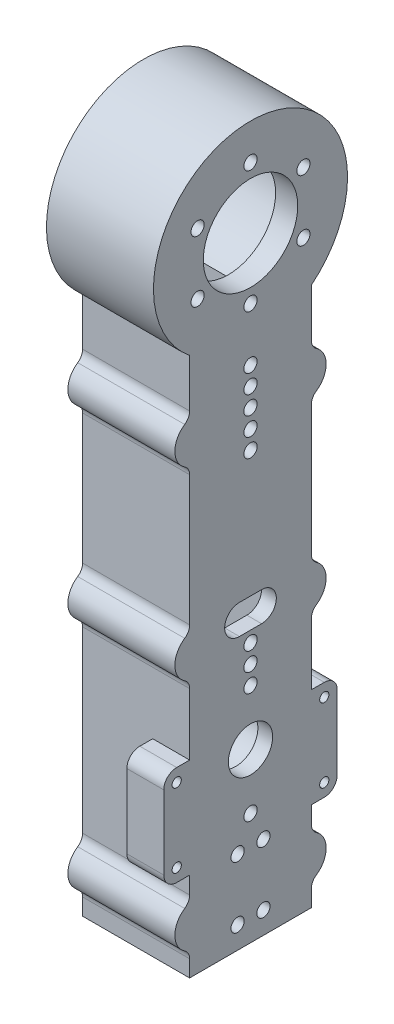
from build123d import *

# Parameters (mm, degrees)
SKETCH2_R                 = 20.3
SKETCH2_R_2               = 12.8
SKETCH2_R_3               = 8
SKETCH2_R_4               = 6
BOSS_EXTRUDE1_DEPTH       = 29
CUT_EXTRUDE1_START        = -29
SKETCH2_3_R               = 20.3
SKETCH2_3_R_2             = 12.8
CUT_EXTRUDE1_DEPTH        = 23
CUT_EXTRUDE3_START        = -29
SKETCH2_5_R               = 8
CUT_EXTRUDE3_DEPTH        = 8
CUT_EXTRUDE4_START        = -21
CUT_EXTRUDE4_DEPTH        = 17
CUT_EXTRUDE5_START        = -29
SKETCH2_7_R               = 8
CUT_EXTRUDE5_DEPTH        = 25
CUT_EXTRUDE6_START        = -29
CUT_EXTRUDE6_DEPTH        = 19
CUT_EXTRUDE7_START        = -29
CUT_EXTRUDE7_DEPTH        = 19
M3_CLEARANCE_HOLE1_D      = 3.6
M3X0_5_TAPPED_HOLE1_D     = 3.6
M3X0_5_TAPPED_HOLE1_DEPTH = 7.5
M3X0_5_TAPPED_HOLE1_TIP   = 1.081549114
M3_CLEARANCE_HOLE2_D      = 3.6
CIRPATTERN1_COUNT         = 6
M3X0_5_TAPPED_HOLE2_D     = 2.5
BOSS_EXTRUDE2_START       = -29
BOSS_EXTRUDE2_OUTLINE_R   = 6
BOSS_EXTRUDE2_DEPTH       = 8
FILLET1_R                 = 5
FILLET2_R                 = 5
M3X0_5_TAPPED_HOLE3_D     = 2.5
M3X0_5_TAPPED_HOLE3_DEPTH = 7.5
M3X0_5_TAPPED_HOLE3_TIP   = 0.751075774


# Read off the part's stored shape, not the designer's step: Boss-Extrude2
with BuildPart() as part:
    # Sketch2 → Boss-Extrude1 (new body)
    # profile 1 of 13: a face of its own
    with BuildSketch(Plane(origin=(0, 0, 0), x_dir=(0, 0, -1), z_dir=(1, 0, 0))):
        with BuildLine():
            ThreePointArc((20.3, 0), (16.338451579, -12.047613872), (6, -19.393039989))
            Line((6, -19.393039989), (6, -25.606444501))
            ThreePointArc((6, -25.606444501), (7.258880255, -25.278422764), (8.5, -24.888551585))
            ThreePointArc((8.5, -24.888551585), (11.060877863, -23.860992873), (13.5, -22.570777567))
            ThreePointArc((13.5, -22.570777567), (15.036375651, -21.577706256), (16.5, -20.480234374))
            ThreePointArc((16.5, -20.480234374), (23.723827684, -11.352092318), (26.3, 0))
            ThreePointArc((26.3, 0), (-11.352092318, 23.723827684), (-16.5, -20.480234374))
            ThreePointArc((-16.5, -20.480234374), (-15.036375651, -21.577706256), (-13.5, -22.570777567))
            ThreePointArc((-13.5, -22.570777567), (-11.060877863, -23.860992873), (-8.5, -24.888551585))
            ThreePointArc((-8.5, -24.888551585), (-7.258880255, -25.278422764), (-6, -25.606444501))
            Line((-6, -25.606444501), (-6, -19.393039989))
            ThreePointArc((-6, -19.393039989), (-12.047613872, 16.338451579), (20.3, 0))
        make_face()
    # profile 2 of 13: a face of its own
    with BuildSketch(Plane(origin=(0, 0, 0), x_dir=(0, 0, -1), z_dir=(1, 0, 0))):
        with BuildLine():
            Line((6, -25.606444501), (6, -19.393039989))
            ThreePointArc((6, -19.393039989), (0, -20.3), (-6, -19.393039989))
            Line((-6, -19.393039989), (-6, -25.606444501))
            ThreePointArc((-6, -25.606444501), (0, -26.3), (6, -25.606444501))
        make_face()
    # profile 3 of 13: a face of its own
    with BuildSketch(Plane(origin=(0, 0, 0), x_dir=(0, 0, -1), z_dir=(1, 0, 0))):
        Circle(SKETCH2_R)
        Circle(SKETCH2_R_2, mode=Mode.SUBTRACT)
    # profile 4 of 13: a face of its own
    with BuildSketch(Plane(origin=(0, 0, 0), x_dir=(0, 0, -1), z_dir=(1, 0, 0))):
        with BuildLine():
            ThreePointArc((20.3, 0), (16.338451579, -12.047613872), (6, -19.393039989))
            Line((6, -19.393039989), (6, -25.606444501))
            ThreePointArc((6, -25.606444501), (7.258880255, -25.278422764), (8.5, -24.888551585))
            ThreePointArc((8.5, -24.888551585), (11.060877863, -23.860992873), (13.5, -22.570777567))
            ThreePointArc((13.5, -22.570777567), (15.036375651, -21.577706256), (16.5, -20.480234374))
            ThreePointArc((16.5, -20.480234374), (23.723827684, -11.352092318), (26.3, 0))
            ThreePointArc((26.3, 0), (-11.352092318, 23.723827684), (-16.5, -20.480234374))
            ThreePointArc((-16.5, -20.480234374), (-15.036375651, -21.577706256), (-13.5, -22.570777567))
            ThreePointArc((-13.5, -22.570777567), (-11.060877863, -23.860992873), (-8.5, -24.888551585))
            ThreePointArc((-8.5, -24.888551585), (-7.258880255, -25.278422764), (-6, -25.606444501))
            Line((-6, -25.606444501), (-6, -19.393039989))
            ThreePointArc((-6, -19.393039989), (-12.047613872, 16.338451579), (20.3, 0))
        make_face()
    # profile 5 of 13: a face of its own
    with BuildSketch(Plane(origin=(0, 0, 0), x_dir=(0, 0, -1), z_dir=(1, 0, 0))):
        with BuildLine():
            Line((6, -25.606444501), (6, -19.393039989))
            ThreePointArc((6, -19.393039989), (0, -20.3), (-6, -19.393039989))
            Line((-6, -19.393039989), (-6, -25.606444501))
            ThreePointArc((-6, -25.606444501), (0, -26.3), (6, -25.606444501))
        make_face()
    # profile 6 of 13: a face of its own
    with BuildSketch(Plane(origin=(0, 0, 0), x_dir=(0, 0, -1), z_dir=(1, 0, 0))):
        with BuildLine():
            ThreePointArc((16.5, -20.480234374), (15.036375651, -21.577706256), (13.5, -22.570777567))
            Line((13.5, -22.570777567), (13.5, -33.516685226))
            ThreePointArc((13.5, -33.516685226), (14.208497378, -36.345112351), (16.166666667, -38.505561742))
            ThreePointArc((16.166666667, -38.505561742), (17.5, -41), (16.166666667, -43.494438258))
            ThreePointArc((16.166666667, -43.494438258), (14.208497378, -45.654887649), (13.5, -48.483314774))
            Line((13.5, -48.483314774), (13.5, -83.716685226))
            ThreePointArc((13.5, -83.716685226), (14.208497378, -86.545112351), (16.166666667, -88.705561742))
            ThreePointArc((16.166666667, -88.705561742), (17.5, -91.2), (16.166666667, -93.694438258))
            ThreePointArc((16.166666667, -93.694438258), (14.208497378, -95.854887649), (13.5, -98.683314774))
            Line((13.5, -98.683314774), (13.5, -147.122068421))
            ThreePointArc((13.5, -147.122068421), (14.208497378, -149.950495546), (16.166666667, -152.110944937))
            ThreePointArc((16.166666667, -152.110944937), (17.5, -154.605383194), (16.166666667, -157.099821452))
            ThreePointArc((16.166666667, -157.099821452), (14.208497378, -159.260270843), (13.5, -162.088697968))
            Line((13.5, -162.088697968), (13.5, -166.605383194))
            Line((13.5, -166.605383194), (16.5, -166.605383194))
            Line((16.5, -166.605383194), (16.5, -162.088697968))
            ThreePointArc((16.5, -162.088697968), (16.854248689, -160.674484406), (17.833333333, -159.59425971))
            ThreePointArc((17.833333333, -159.59425971), (20.5, -154.605383194), (17.833333333, -149.616506679))
            ThreePointArc((17.833333333, -149.616506679), (16.854248689, -148.536281983), (16.5, -147.122068421))
            Line((16.5, -147.122068421), (16.5, -142.45))
            Line((16.5, -142.45), (16.5, -115.45))
            Line((16.5, -115.45), (16.5, -98.683314774))
            ThreePointArc((16.5, -98.683314774), (16.854248689, -97.269101211), (17.833333333, -96.188876516))
            ThreePointArc((17.833333333, -96.188876516), (20.5, -91.2), (17.833333333, -86.211123484))
            ThreePointArc((17.833333333, -86.211123484), (16.854248689, -85.130898789), (16.5, -83.716685226))
            Line((16.5, -83.716685226), (16.5, -48.483314774))
            ThreePointArc((16.5, -48.483314774), (16.854248689, -47.069101211), (17.833333333, -45.988876516))
            ThreePointArc((17.833333333, -45.988876516), (20.5, -41), (17.833333333, -36.011123484))
            ThreePointArc((17.833333333, -36.011123484), (16.854248689, -34.930898789), (16.5, -33.516685226))
            Line((16.5, -33.516685226), (16.5, -20.480234374))
        make_face()
    # profile 7 of 13: a face of its own
    with BuildSketch(Plane(origin=(0, 0, 0), x_dir=(0, 0, -1), z_dir=(1, 0, 0))):
        with BuildLine():
            ThreePointArc((13.5, -22.570777567), (11.060877863, -23.860992873), (8.5, -24.888551585))
            Line((8.5, -24.888551585), (8.5, -105.396519371))
            ThreePointArc((8.5, -105.396519371), (6.397114317, -109.958591268), (1.5625, -111.322824607))
            ThreePointArc((1.5625, -111.322824607), (0, -111.2), (-1.5625, -111.322824607))
            ThreePointArc((-1.5625, -111.322824607), (-6.397114317, -109.958591268), (-8.5, -105.396519371))
            Line((-8.5, -105.396519371), (-8.5, -24.888551585))
            ThreePointArc((-8.5, -24.888551585), (-11.060877863, -23.860992873), (-13.5, -22.570777567))
            Line((-13.5, -22.570777567), (-13.5, -33.516685226))
            ThreePointArc((-13.5, -33.516685226), (-14.208497378, -36.345112351), (-16.166666667, -38.505561742))
            ThreePointArc((-16.166666667, -38.505561742), (-17.5, -41), (-16.166666667, -43.494438258))
            ThreePointArc((-16.166666667, -43.494438258), (-14.208497378, -45.654887649), (-13.5, -48.483314774))
            Line((-13.5, -48.483314774), (-13.5, -83.716685226))
            ThreePointArc((-13.5, -83.716685226), (-14.208497378, -86.545112351), (-16.166666667, -88.705561742))
            ThreePointArc((-16.166666667, -88.705561742), (-17.5, -91.2), (-16.166666667, -93.694438258))
            ThreePointArc((-16.166666667, -93.694438258), (-14.208497378, -95.854887649), (-13.5, -98.683314774))
            Line((-13.5, -98.683314774), (-13.5, -147.122068421))
            ThreePointArc((-13.5, -147.122068421), (-14.208497378, -149.950495546), (-16.166666667, -152.110944937))
            ThreePointArc((-16.166666667, -152.110944937), (-17.5, -154.605383194), (-16.166666667, -157.099821452))
            ThreePointArc((-16.166666667, -157.099821452), (-14.208497378, -159.260270843), (-13.5, -162.088697968))
            Line((-13.5, -162.088697968), (-13.5, -166.605383194))
            Line((-13.5, -166.605383194), (-8.5, -166.605383194))
            Line((-8.5, -166.605383194), (-8.5, -137.003480629))
            ThreePointArc((-8.5, -137.003480629), (-6.397114317, -132.441408732), (-1.5625, -131.077175393))
            ThreePointArc((-1.5625, -131.077175393), (0, -131.2), (1.5625, -131.077175393))
            ThreePointArc((1.5625, -131.077175393), (6.397114317, -132.441408732), (8.5, -137.003480629))
            Line((8.5, -137.003480629), (8.5, -166.605383194))
            Line((8.5, -166.605383194), (13.5, -166.605383194))
            Line((13.5, -166.605383194), (13.5, -162.088697968))
            ThreePointArc((13.5, -162.088697968), (14.208497378, -159.260270843), (16.166666667, -157.099821452))
            ThreePointArc((16.166666667, -157.099821452), (17.5, -154.605383194), (16.166666667, -152.110944937))
            ThreePointArc((16.166666667, -152.110944937), (14.208497378, -149.950495546), (13.5, -147.122068421))
            Line((13.5, -147.122068421), (13.5, -98.683314774))
            ThreePointArc((13.5, -98.683314774), (14.208497378, -95.854887649), (16.166666667, -93.694438258))
            ThreePointArc((16.166666667, -93.694438258), (17.5, -91.2), (16.166666667, -88.705561742))
            ThreePointArc((16.166666667, -88.705561742), (14.208497378, -86.545112351), (13.5, -83.716685226))
            Line((13.5, -83.716685226), (13.5, -48.483314774))
            ThreePointArc((13.5, -48.483314774), (14.208497378, -45.654887649), (16.166666667, -43.494438258))
            ThreePointArc((16.166666667, -43.494438258), (17.5, -41), (16.166666667, -38.505561742))
            ThreePointArc((16.166666667, -38.505561742), (14.208497378, -36.345112351), (13.5, -33.516685226))
            Line((13.5, -33.516685226), (13.5, -22.570777567))
        make_face()
        with Locations((0, -121.2)):
            Circle(SKETCH2_R_3, mode=Mode.SUBTRACT)
    # profile 8 of 13: a face of its own
    with BuildSketch(Plane(origin=(0, 0, 0), x_dir=(0, 0, -1), z_dir=(1, 0, 0))):
        with BuildLine():
            ThreePointArc((8.5, -24.888551585), (7.258880255, -25.278422764), (6, -25.606444501))
            ThreePointArc((6, -25.606444501), (0, -26.3), (-6, -25.606444501))
            ThreePointArc((-6, -25.606444501), (-7.258880255, -25.278422764), (-8.5, -24.888551585))
            Line((-8.5, -24.888551585), (-8.5, -105.396519371))
            ThreePointArc((-8.5, -105.396519371), (-6.397114317, -109.958591268), (-1.5625, -111.322824607))
            ThreePointArc((-1.5625, -111.322824607), (0, -111.2), (1.5625, -111.322824607))
            ThreePointArc((1.5625, -111.322824607), (6.397114317, -109.958591268), (8.5, -105.396519371))
            Line((8.5, -105.396519371), (8.5, -24.888551585))
        make_face()
        with BuildLine():
            ThreePointArc((-3, -93.2), (-7, -89.2), (-3, -85.2))
            Line((-3, -85.2), (3, -85.2))
            ThreePointArc((3, -85.2), (7, -89.2), (3, -93.2))
            Line((3, -93.2), (-3, -93.2))
        make_face(mode=Mode.SUBTRACT)
    # profile 9 of 13: a face of its own
    with BuildSketch(Plane(origin=(0, 0, 0), x_dir=(0, 0, -1), z_dir=(1, 0, 0))):
        with BuildLine():
            Line((-13.5, -33.516685226), (-13.5, -22.570777567))
            ThreePointArc((-13.5, -22.570777567), (-15.036375651, -21.577706256), (-16.5, -20.480234374))
            Line((-16.5, -20.480234374), (-16.5, -33.516685226))
            ThreePointArc((-16.5, -33.516685226), (-16.854248689, -34.930898789), (-17.833333333, -36.011123484))
            ThreePointArc((-17.833333333, -36.011123484), (-20.5, -41), (-17.833333333, -45.988876516))
            ThreePointArc((-17.833333333, -45.988876516), (-16.854248689, -47.069101211), (-16.5, -48.483314774))
            Line((-16.5, -48.483314774), (-16.5, -83.716685226))
            ThreePointArc((-16.5, -83.716685226), (-16.854248689, -85.130898789), (-17.833333333, -86.211123484))
            ThreePointArc((-17.833333333, -86.211123484), (-20.5, -91.2), (-17.833333333, -96.188876516))
            ThreePointArc((-17.833333333, -96.188876516), (-16.854248689, -97.269101211), (-16.5, -98.683314774))
            Line((-16.5, -98.683314774), (-16.5, -115.45))
            Line((-16.5, -115.45), (-16.5, -142.45))
            Line((-16.5, -142.45), (-16.5, -147.122068421))
            ThreePointArc((-16.5, -147.122068421), (-16.854248689, -148.536281983), (-17.833333333, -149.616506679))
            ThreePointArc((-17.833333333, -149.616506679), (-20.5, -154.605383194), (-17.833333333, -159.59425971))
            ThreePointArc((-17.833333333, -159.59425971), (-16.854248689, -160.674484406), (-16.5, -162.088697968))
            Line((-16.5, -162.088697968), (-16.5, -166.605383194))
            Line((-16.5, -166.605383194), (-13.5, -166.605383194))
            Line((-13.5, -166.605383194), (-13.5, -162.088697968))
            ThreePointArc((-13.5, -162.088697968), (-14.208497378, -159.260270843), (-16.166666667, -157.099821452))
            ThreePointArc((-16.166666667, -157.099821452), (-17.5, -154.605383194), (-16.166666667, -152.110944937))
            ThreePointArc((-16.166666667, -152.110944937), (-14.208497378, -149.950495546), (-13.5, -147.122068421))
            Line((-13.5, -147.122068421), (-13.5, -98.683314774))
            ThreePointArc((-13.5, -98.683314774), (-14.208497378, -95.854887649), (-16.166666667, -93.694438258))
            ThreePointArc((-16.166666667, -93.694438258), (-17.5, -91.2), (-16.166666667, -88.705561742))
            ThreePointArc((-16.166666667, -88.705561742), (-14.208497378, -86.545112351), (-13.5, -83.716685226))
            Line((-13.5, -83.716685226), (-13.5, -48.483314774))
            ThreePointArc((-13.5, -48.483314774), (-14.208497378, -45.654887649), (-16.166666667, -43.494438258))
            ThreePointArc((-16.166666667, -43.494438258), (-17.5, -41), (-16.166666667, -38.505561742))
            ThreePointArc((-16.166666667, -38.505561742), (-14.208497378, -36.345112351), (-13.5, -33.516685226))
        make_face()
    # profile 10 of 13: a face of its own
    with BuildSketch(Plane(origin=(0, 0, 0), x_dir=(0, 0, -1), z_dir=(1, 0, 0))):
        with Locations((0, -121.2)):
            Circle(SKETCH2_R_3)
        with Locations((0, -121.2)):
            Circle(SKETCH2_R_4, mode=Mode.SUBTRACT)
    # profile 11 of 13: a face of its own
    with BuildSketch(Plane(origin=(0, 0, 0), x_dir=(0, 0, -1), z_dir=(1, 0, 0))):
        with BuildLine():
            ThreePointArc((-1.5625, -131.077175393), (0, -131.2), (1.5625, -131.077175393))
            ThreePointArc((1.5625, -131.077175393), (6.397114317, -132.441408732), (8.5, -137.003480629))
            Line((8.5, -137.003480629), (8.5, -166.605383194))
            Line((8.5, -166.605383194), (-8.5, -166.605383194))
            Line((-8.5, -166.605383194), (-8.5, -137.003480629))
            ThreePointArc((-8.5, -137.003480629), (-6.397114317, -132.441408732), (-1.5625, -131.077175393))
        make_face()
    # profile 12 of 13: a face of its own
    with BuildSketch(Plane(origin=(0, 0, 0), x_dir=(0, 0, -1), z_dir=(1, 0, 0))):
        with BuildLine():
            Line((-16.5, -142.45), (-16.5, -115.45))
            Line((-16.5, -115.45), (-20, -115.45))
            ThreePointArc((-20, -115.45), (-22.474873734, -116.475126266), (-23.5, -118.95))
            Line((-23.5, -118.95), (-23.5, -138.95))
            ThreePointArc((-23.5, -138.95), (-22.474873734, -141.424873734), (-20, -142.45))
            Line((-20, -142.45), (-16.5, -142.45))
        make_face()
    # profile 13 of 13: a face of its own
    with BuildSketch(Plane(origin=(0, 0, 0), x_dir=(0, 0, -1), z_dir=(1, 0, 0))):
        with BuildLine():
            Line((20, -115.45), (16.5, -115.45))
            Line((16.5, -115.45), (16.5, -142.45))
            Line((16.5, -142.45), (20, -142.45))
            ThreePointArc((20, -142.45), (22.474873734, -141.424873734), (23.5, -138.95))
            Line((23.5, -138.95), (23.5, -118.95))
            ThreePointArc((23.5, -118.95), (22.474873734, -116.475126266), (20, -115.45))
        make_face()
    extrude(amount=-BOSS_EXTRUDE1_DEPTH)

    # Sketch2<3> → Cut-Extrude1 (cut)
    # profile 1 of 2: a face of its own
    with BuildSketch(Plane(origin=(0, 0, 0), x_dir=(0, 0, -1), z_dir=(1, 0, 0)).offset(CUT_EXTRUDE1_START)):
        Circle(SKETCH2_3_R)
        Circle(SKETCH2_3_R_2, mode=Mode.SUBTRACT)
    # profile 2 of 2: a face of its own
    with BuildSketch(Plane(origin=(0, 0, 0), x_dir=(0, 0, -1), z_dir=(1, 0, 0)).offset(CUT_EXTRUDE1_START)):
        Circle(SKETCH2_3_R_2)
    extrude(amount=CUT_EXTRUDE1_DEPTH, mode=Mode.SUBTRACT)

    # Sketch2<5> → Cut-Extrude3 (cut)
    with BuildSketch(Plane(origin=(0, 0, 0), x_dir=(0, 0, -1), z_dir=(1, 0, 0)).offset(CUT_EXTRUDE3_START)):
        with BuildLine():
            Line((-13.5, -22.570777567), (-13.5, -33.516685226))
            ThreePointArc((-13.5, -33.516685226), (-14.208497378, -36.345112351), (-16.166666667, -38.505561742))
            ThreePointArc((-16.166666667, -38.505561742), (-17.5, -41), (-16.166666667, -43.494438258))
            ThreePointArc((-16.166666667, -43.494438258), (-14.208497378, -45.654887649), (-13.5, -48.483314774))
            Line((-13.5, -48.483314774), (-13.5, -83.716685226))
            ThreePointArc((-13.5, -83.716685226), (-14.208497378, -86.545112351), (-16.166666667, -88.705561742))
            ThreePointArc((-16.166666667, -88.705561742), (-17.5, -91.2), (-16.166666667, -93.694438258))
            ThreePointArc((-16.166666667, -93.694438258), (-14.208497378, -95.854887649), (-13.5, -98.683314774))
            Line((-13.5, -98.683314774), (-13.5, -147.122068421))
            ThreePointArc((-13.5, -147.122068421), (-14.208497378, -149.950495546), (-16.166666667, -152.110944937))
            ThreePointArc((-16.166666667, -152.110944937), (-17.5, -154.605383194), (-16.166666667, -157.099821452))
            ThreePointArc((-16.166666667, -157.099821452), (-14.208497378, -159.260270843), (-13.5, -162.088697968))
            Line((-13.5, -162.088697968), (-13.5, -166.605383194))
            Line((-13.5, -166.605383194), (13.5, -166.605383194))
            Line((13.5, -166.605383194), (13.5, -162.088697968))
            ThreePointArc((13.5, -162.088697968), (14.208497378, -159.260270843), (16.166666667, -157.099821452))
            ThreePointArc((16.166666667, -157.099821452), (17.5, -154.605383194), (16.166666667, -152.110944937))
            ThreePointArc((16.166666667, -152.110944937), (14.208497378, -149.950495546), (13.5, -147.122068421))
            Line((13.5, -147.122068421), (13.5, -98.683314774))
            ThreePointArc((13.5, -98.683314774), (14.208497378, -95.854887649), (16.166666667, -93.694438258))
            ThreePointArc((16.166666667, -93.694438258), (17.5, -91.2), (16.166666667, -88.705561742))
            ThreePointArc((16.166666667, -88.705561742), (14.208497378, -86.545112351), (13.5, -83.716685226))
            Line((13.5, -83.716685226), (13.5, -48.483314774))
            ThreePointArc((13.5, -48.483314774), (14.208497378, -45.654887649), (16.166666667, -43.494438258))
            ThreePointArc((16.166666667, -43.494438258), (17.5, -41), (16.166666667, -38.505561742))
            ThreePointArc((16.166666667, -38.505561742), (14.208497378, -36.345112351), (13.5, -33.516685226))
            Line((13.5, -33.516685226), (13.5, -22.570777567))
            ThreePointArc((13.5, -22.570777567), (0, -26.3), (-13.5, -22.570777567))
        make_face()
        with BuildLine():
            ThreePointArc((-3, -93.2), (-7, -89.2), (-3, -85.2))
            Line((-3, -85.2), (3, -85.2))
            ThreePointArc((3, -85.2), (7, -89.2), (3, -93.2))
            Line((3, -93.2), (-3, -93.2))
        make_face(mode=Mode.SUBTRACT)
        with Locations((0, -121.2)):
            Circle(SKETCH2_5_R, mode=Mode.SUBTRACT)
    extrude(amount=CUT_EXTRUDE3_DEPTH, mode=Mode.SUBTRACT)

    # Sketch2<6> → Cut-Extrude4 (cut)
    # profile 1 of 2: a face of its own
    with BuildSketch(Plane(origin=(0, 0, 0), x_dir=(0, 0, -1), z_dir=(1, 0, 0)).offset(CUT_EXTRUDE4_START)):
        with BuildLine():
            ThreePointArc((8.5, -24.888551585), (0, -26.3), (-8.5, -24.888551585))
            Line((-8.5, -24.888551585), (-8.5, -105.396519371))
            ThreePointArc((-8.5, -105.396519371), (-6.397114317, -109.958591268), (-1.5625, -111.322824607))
            ThreePointArc((-1.5625, -111.322824607), (0, -111.2), (1.5625, -111.322824607))
            ThreePointArc((1.5625, -111.322824607), (6.397114317, -109.958591268), (8.5, -105.396519371))
            Line((8.5, -105.396519371), (8.5, -24.888551585))
        make_face()
        with BuildLine():
            ThreePointArc((-3, -93.2), (-7, -89.2), (-3, -85.2))
            Line((-3, -85.2), (3, -85.2))
            ThreePointArc((3, -85.2), (7, -89.2), (3, -93.2))
            Line((3, -93.2), (-3, -93.2))
        make_face(mode=Mode.SUBTRACT)
    # profile 2 of 2: a face of its own
    with BuildSketch(Plane(origin=(0, 0, 0), x_dir=(0, 0, -1), z_dir=(1, 0, 0)).offset(CUT_EXTRUDE4_START)):
        with BuildLine():
            Line((-8.5, -166.605383194), (8.5, -166.605383194))
            Line((8.5, -166.605383194), (8.5, -137.003480629))
            ThreePointArc((8.5, -137.003480629), (6.397114317, -132.441408732), (1.5625, -131.077175393))
            ThreePointArc((1.5625, -131.077175393), (0, -131.2), (-1.5625, -131.077175393))
            ThreePointArc((-1.5625, -131.077175393), (-6.397114317, -132.441408732), (-8.5, -137.003480629))
            Line((-8.5, -137.003480629), (-8.5, -166.605383194))
        make_face()
    extrude(amount=CUT_EXTRUDE4_DEPTH, mode=Mode.SUBTRACT)

    # Sketch2<7> → Cut-Extrude5 (cut)
    with BuildSketch(Plane(origin=(0, 0, 0), x_dir=(0, 0, -1), z_dir=(1, 0, 0)).offset(CUT_EXTRUDE5_START)):
        with Locations((0, -121.2)):
            Circle(SKETCH2_7_R)
    extrude(amount=CUT_EXTRUDE5_DEPTH, mode=Mode.SUBTRACT)

    # Sketch2<8> → Cut-Extrude6 (cut)
    with BuildSketch(Plane(origin=(0, 0, 0), x_dir=(0, 0, -1), z_dir=(1, 0, 0)).offset(CUT_EXTRUDE6_START)):
        with BuildLine():
            Line((6, -25.606444501), (6, -19.393039989))
            ThreePointArc((6, -19.393039989), (0, -20.3), (-6, -19.393039989))
            Line((-6, -19.393039989), (-6, -25.606444501))
            ThreePointArc((-6, -25.606444501), (0, -26.3), (6, -25.606444501))
        make_face()
    extrude(amount=CUT_EXTRUDE6_DEPTH, mode=Mode.SUBTRACT)

    # Sketch2<9> → Cut-Extrude7 (cut)
    with BuildSketch(Plane(origin=(0, 0, 0), x_dir=(0, 0, -1), z_dir=(1, 0, 0)).offset(CUT_EXTRUDE7_START)):
        with BuildLine():
            Line((-16.5, -142.45), (-16.5, -115.45))
            Line((-16.5, -115.45), (-20, -115.45))
            ThreePointArc((-20, -115.45), (-22.474873734, -116.475126266), (-23.5, -118.95))
            Line((-23.5, -118.95), (-23.5, -138.95))
            ThreePointArc((-23.5, -138.95), (-22.474873734, -141.424873734), (-20, -142.45))
            Line((-20, -142.45), (-16.5, -142.45))
        make_face()
        with BuildLine():
            Line((20, -115.45), (16.5, -115.45))
            Line((16.5, -115.45), (16.5, -142.45))
            Line((16.5, -142.45), (20, -142.45))
            ThreePointArc((20, -142.45), (22.474873734, -141.424873734), (23.5, -138.95))
            Line((23.5, -138.95), (23.5, -118.95))
            ThreePointArc((23.5, -118.95), (22.474873734, -116.475126266), (20, -115.45))
        make_face()
    extrude(amount=CUT_EXTRUDE7_DEPTH, mode=Mode.SUBTRACT)

    # M3 Clearance Hole1 (through all)
    with Locations(Plane.ZY.offset(4)):
        with Locations((0, -31), (0, -36), (0, -41), (0, -46), (0, -51), (0, -96.2), (0, -101.2), (0, -106.2), (0, -136.2)):
            Hole(M3_CLEARANCE_HOLE1_D / 2)

    # M3x0.5 Tapped Hole1
    with Locations(Plane(origin=(0, 0, 0), x_dir=(0, 0, -1), z_dir=(1, 0, 0))):
        with Locations((-3.5, -144.022259243), (3.5, -160.605383194), (3.5, -144.022259243), (-3.5, -160.605383194)):
            Hole(M3X0_5_TAPPED_HOLE1_D / 2, depth=M3X0_5_TAPPED_HOLE1_DEPTH)
            with Locations((0, 0, -(M3X0_5_TAPPED_HOLE1_DEPTH + M3X0_5_TAPPED_HOLE1_TIP / 2))):  # 118° drill point
                Cone(0, M3X0_5_TAPPED_HOLE1_D / 2, M3X0_5_TAPPED_HOLE1_TIP, mode=Mode.SUBTRACT)

    # M3 Clearance Hole2 (through all)
    with Locations(Plane(origin=(0, 0, 0), x_dir=(0, 0, -1), z_dir=(1, 0, 0))):
        with Locations((0, 16.55)):
            m3_clearance_hole2 = Hole(M3_CLEARANCE_HOLE2_D / 2)

    # CirPattern1: M3 Clearance Hole2 ×6 about axis
    cirpattern1_axis = Axis((0, 0, 0), (1, 0, 0))
    for i in range(1, CIRPATTERN1_COUNT):
        add(m3_clearance_hole2.rotate(cirpattern1_axis, i * 360 / CIRPATTERN1_COUNT), mode=Mode.SUBTRACT)

    # M3x0.5 Tapped Hole2 (through all)
    with Locations(Plane(origin=(0, 0, 0), x_dir=(0, 0, -1), z_dir=(1, 0, 0))):
        with Locations((-20, -118.95), (20, -118.95), (-20, -138.95), (20, -138.95)):
            Hole(M3X0_5_TAPPED_HOLE2_D / 2)

    # Fillet1
    # the kernel refuses this fillet: 5 mm, written as the material it adds along each edge
    with BuildSketch(Plane(origin=(-21, -24.888551585, 8.5), x_dir=(0, -0.21879464972188295, -0.9757709266283141), z_dir=(1, 0, 0))) as fillet1_piece_1_section:
        with BuildLine():
            CenterArc((6.238695313, -4.970585469), FILLET1_R, 96.217942965, 96.420303878)
            Line((1.35984068, -6.064558717), (0, 0))
            ThreePointArc((0, 0), (2.84857095, -0.154720435), (5.6971419, 0))
        make_face()
    fillet1_piece_1 = extrude(amount=17, mode=Mode.PRIVATE)
    fillet1_piece_1 = split(fillet1_piece_1, bisect_by=Plane(origin=(-10, -26.861224257, 7.623932131), z_dir=(-1, 0, 0)), keep=Keep.TOP, mode=Mode.PRIVATE)
    fillet1_piece_1 = split(fillet1_piece_1, bisect_by=Plane(origin=(-15.5, -26.861224257, 6), z_dir=(0, 0, 1)), keep=Keep.TOP, mode=Mode.PRIVATE)
    add(fillet1_piece_1)
    with BuildSketch(Plane(origin=(-21, -24.888551585, 8.5), x_dir=(0, -0.21879464972188295, -0.9757709266283141), z_dir=(1, 0, 0))) as fillet1_piece_2_section:
        with BuildLine():
            CenterArc((6.238695313, -4.970585469), FILLET1_R, 96.217942965, 96.420303878)
            Line((1.35984068, -6.064558717), (0, 0))
            ThreePointArc((0, 0), (2.84857095, -0.154720435), (5.6971419, 0))
        make_face()
    fillet1_piece_2 = extrude(amount=17, mode=Mode.PRIVATE)
    fillet1_piece_2 = split(fillet1_piece_2, bisect_by=Plane(origin=(-10, -26.056743064, 5.079667211), z_dir=(1, 0, 0)), keep=Keep.TOP, mode=Mode.PRIVATE)
    fillet1_piece_2 = split(fillet1_piece_2, bisect_by=Plane(origin=(-7, -26.056743064, 6), z_dir=(0, 0, -1)), keep=Keep.TOP, mode=Mode.PRIVATE)
    add(fillet1_piece_2)
    with BuildSketch(Plane(origin=(-21, -24.888551585, 8.5), x_dir=(0, -0.21879464972188295, -0.9757709266283141), z_dir=(1, 0, 0))) as fillet1_piece_3_section:
        with BuildLine():
            CenterArc((6.238695313, -4.970585469), FILLET1_R, 96.217942965, 96.420303878)
            Line((1.35984068, -6.064558717), (0, 0))
            ThreePointArc((0, 0), (2.84857095, -0.154720435), (5.6971419, 0))
        make_face()
    fillet1_piece_3 = extrude(amount=17, mode=Mode.PRIVATE)
    fillet1_piece_3 = split(fillet1_piece_3, bisect_by=Plane(origin=(-10, -26.861224257, 7.623932131), z_dir=(1, 0, 0)), keep=Keep.TOP, mode=Mode.PRIVATE)
    fillet1_piece_3 = split(fillet1_piece_3, bisect_by=Plane(origin=(-7, -26.861224257, 6), z_dir=(0, 0, 1)), keep=Keep.TOP, mode=Mode.PRIVATE)
    add(fillet1_piece_3)
    with BuildSketch(Plane(origin=(-21, -24.888551585, -8.5), x_dir=(0, -0.21879464972188428, 0.9757709266283138), z_dir=(1, 0, 0))) as fillet1_piece_4_section:
        with BuildLine():
            CenterArc((6.238695313, 4.970585469), FILLET1_R, 167.361753157, 96.420303878)
            Line((1.35984068, 6.064558717), (0, 0))
            ThreePointArc((0, 0), (2.84857095, 0.154720435), (5.6971419, 0))
        make_face()
    fillet1_piece_4 = extrude(amount=17, mode=Mode.PRIVATE)
    fillet1_piece_4 = split(fillet1_piece_4, bisect_by=Plane(origin=(-15.5, -26.861224257, -6), z_dir=(0, 0, -1)), keep=Keep.TOP, mode=Mode.PRIVATE)
    fillet1_piece_4 = split(fillet1_piece_4, bisect_by=Plane(origin=(-10, -26.861224257, -7.623932131), z_dir=(-1, 0, 0)), keep=Keep.TOP, mode=Mode.PRIVATE)
    add(fillet1_piece_4)
    with BuildSketch(Plane(origin=(-21, -24.888551585, -8.5), x_dir=(0, -0.21879464972188428, 0.9757709266283138), z_dir=(1, 0, 0))) as fillet1_piece_5_section:
        with BuildLine():
            CenterArc((6.238695313, 4.970585469), FILLET1_R, 167.361753157, 96.420303878)
            Line((1.35984068, 6.064558717), (0, 0))
            ThreePointArc((0, 0), (2.84857095, 0.154720435), (5.6971419, 0))
        make_face()
    fillet1_piece_5 = extrude(amount=17, mode=Mode.PRIVATE)
    fillet1_piece_5 = split(fillet1_piece_5, bisect_by=Plane(origin=(-7, -26.056743064, -6), z_dir=(0, 0, 1)), keep=Keep.TOP, mode=Mode.PRIVATE)
    fillet1_piece_5 = split(fillet1_piece_5, bisect_by=Plane(origin=(-10, -26.056743064, -5.079667211), z_dir=(1, 0, 0)), keep=Keep.TOP, mode=Mode.PRIVATE)
    add(fillet1_piece_5)
    with BuildSketch(Plane(origin=(-21, -24.888551585, -8.5), x_dir=(0, -0.21879464972188428, 0.9757709266283138), z_dir=(1, 0, 0))) as fillet1_piece_6_section:
        with BuildLine():
            CenterArc((6.238695313, 4.970585469), FILLET1_R, 167.361753157, 96.420303878)
            Line((1.35984068, 6.064558717), (0, 0))
            ThreePointArc((0, 0), (2.84857095, 0.154720435), (5.6971419, 0))
        make_face()
    fillet1_piece_6 = extrude(amount=17, mode=Mode.PRIVATE)
    fillet1_piece_6 = split(fillet1_piece_6, bisect_by=Plane(origin=(-7, -26.861224257, -6), z_dir=(0, 0, -1)), keep=Keep.TOP, mode=Mode.PRIVATE)
    fillet1_piece_6 = split(fillet1_piece_6, bisect_by=Plane(origin=(-10, -26.861224257, -7.623932131), z_dir=(1, 0, 0)), keep=Keep.TOP, mode=Mode.PRIVATE)
    add(fillet1_piece_6)

    # Fillet2
    fillet2_edges = [part.edges().sort_by_distance(p)[0] for p in [
        (-25, -22.570777567, -13.5),
        (-25, -22.570777567, 13.5),
    ]]
    fillet(fillet2_edges, radius=FILLET2_R)

    # M3x0.5 Tapped Hole3
    with Locations(Plane.ZY.offset(21)):
        with Locations((-14.5, -41), (14.5, -41), (-14.5, -91.2), (14.5, -91.2), (-14.5, -154.605383194), (14.5, -154.605383194)):
            Hole(M3X0_5_TAPPED_HOLE3_D / 2, depth=M3X0_5_TAPPED_HOLE3_DEPTH)
            with Locations((0, 0, -(M3X0_5_TAPPED_HOLE3_DEPTH + M3X0_5_TAPPED_HOLE3_TIP / 2))):  # 118° drill point
                Cone(0, M3X0_5_TAPPED_HOLE3_D / 2, M3X0_5_TAPPED_HOLE3_TIP, mode=Mode.SUBTRACT)


with BuildPart() as body_2:
    # Boss-Extrude2 outline → Boss-Extrude2 (new body)
    with BuildSketch(Plane(origin=(0, 0, 0), x_dir=(0, 0, -1), z_dir=(1, 0, 0)).offset(BOSS_EXTRUDE2_START)):
        with BuildLine():
            Line((-13.5, -166.605383194), (13.5, -166.605383194))
            Line((13.5, -166.605383194), (13.5, -162.088697968))
            ThreePointArc((13.5, -162.088697968), (14.208497378, -159.260270843), (16.166666667, -157.099821452))
            ThreePointArc((16.166666667, -157.099821452), (17.5, -154.605383194), (16.166666667, -152.110944937))
            ThreePointArc((16.166666667, -152.110944937), (14.208497378, -149.950495546), (13.5, -147.122068421))
            Line((13.5, -147.122068421), (13.5, -98.683314774))
            ThreePointArc((13.5, -98.683314774), (14.208497378, -95.854887649), (16.166666667, -93.694438258))
            ThreePointArc((16.166666667, -93.694438258), (17.5, -91.2), (16.166666667, -88.705561742))
            ThreePointArc((16.166666667, -88.705561742), (14.208497378, -86.545112351), (13.5, -83.716685226))
            Line((13.5, -83.716685226), (13.5, -48.483314774))
            ThreePointArc((13.5, -48.483314774), (14.208497378, -45.654887649), (16.166666667, -43.494438258))
            ThreePointArc((16.166666667, -43.494438258), (17.5, -41), (16.166666667, -38.505561742))
            ThreePointArc((16.166666667, -38.505561742), (14.208497378, -36.345112351), (13.5, -33.516685226))
            Line((13.5, -33.516685226), (13.5, -22.570777567))
            ThreePointArc((13.5, -22.570777567), (0, -26.3), (-13.5, -22.570777567))
            Line((-13.5, -22.570777567), (-13.5, -33.516685226))
            ThreePointArc((-13.5, -33.516685226), (-14.208497378, -36.345112351), (-16.166666667, -38.505561742))
            ThreePointArc((-16.166666667, -38.505561742), (-17.5, -41), (-16.166666667, -43.494438258))
            ThreePointArc((-16.166666667, -43.494438258), (-14.208497378, -45.654887649), (-13.5, -48.483314774))
            Line((-13.5, -48.483314774), (-13.5, -83.716685226))
            ThreePointArc((-13.5, -83.716685226), (-14.208497378, -86.545112351), (-16.166666667, -88.705561742))
            ThreePointArc((-16.166666667, -88.705561742), (-17.5, -91.2), (-16.166666667, -93.694438258))
            ThreePointArc((-16.166666667, -93.694438258), (-14.208497378, -95.854887649), (-13.5, -98.683314774))
            Line((-13.5, -98.683314774), (-13.5, -147.122068421))
            ThreePointArc((-13.5, -147.122068421), (-14.208497378, -149.950495546), (-16.166666667, -152.110944937))
            ThreePointArc((-16.166666667, -152.110944937), (-17.5, -154.605383194), (-16.166666667, -157.099821452))
            ThreePointArc((-16.166666667, -157.099821452), (-14.208497378, -159.260270843), (-13.5, -162.088697968))
            Line((-13.5, -162.088697968), (-13.5, -166.605383194))
        make_face()
        with Locations((0, -121.2)):
            Circle(BOSS_EXTRUDE2_OUTLINE_R, mode=Mode.SUBTRACT)
    extrude(amount=BOSS_EXTRUDE2_DEPTH)


solid = part.part
